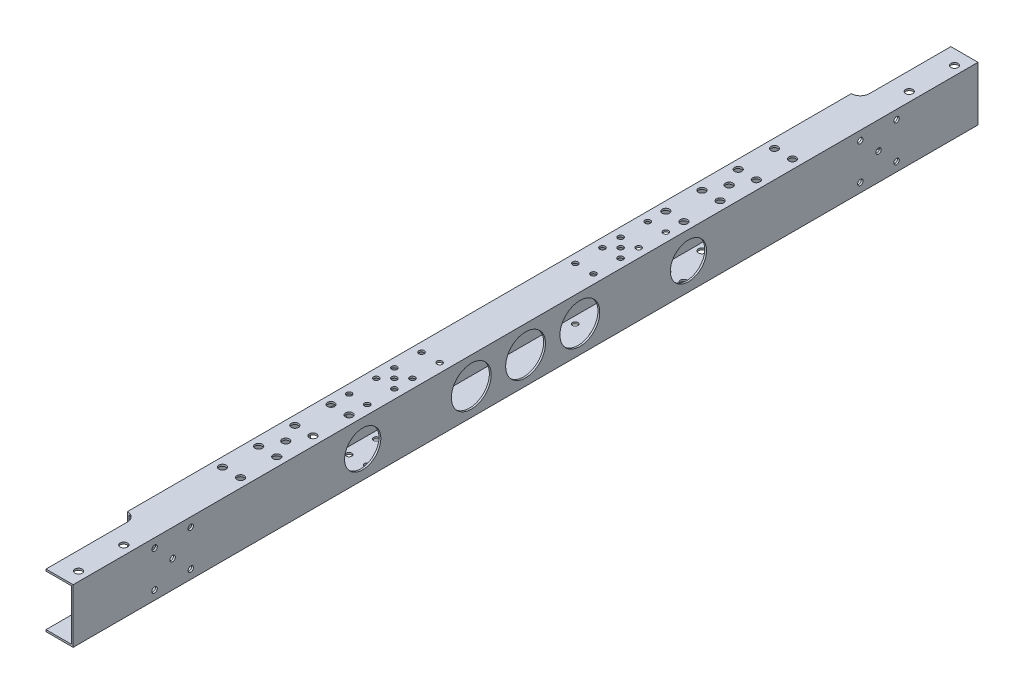
from build123d import *

# Parameters (mm, degrees)
SKETCH_1_W          = 20
SKETCH_1_H          = 30
SKETCH_1_W_2        = 18
SKETCH_1_H_2        = 28
EXTRUDE_1_DEPTH     = 500
CUT_EXTRUDE_1_REACH = 502.999
SKETCH_2_R          = 1.5
CUT_EXTRUDE_3_REACH = 502.999
SKETCH_4_W          = 5
SKETCH_4_H          = 50
FILLET_1_R          = 5
CUT_EXTRUDE_4_REACH = 502.999
SKETCH_5_R          = 2
SKETCH_6_R          = 2
SKETCH_6_R_2        = 1.5
CUT_EXTRUDE_5_DEPTH = 30
CUT_EXTRUDE_6_REACH = 502.625
SKETCH_8_R          = 11
CUT_EXTRUDE_7_REACH = 502.625
SKETCH_9_R          = 1.5
SKETCH_9_R_2        = 10


with BuildPart() as part:
    # 草图1 → 拉伸-薄壁1 (new body)
    with BuildSketch(Plane.XY):
        Rectangle(SKETCH_1_W, SKETCH_1_H)
        Rectangle(SKETCH_1_W_2, SKETCH_1_H_2, mode=Mode.SUBTRACT)
    extrude(amount=EXTRUDE_1_DEPTH)

    # 切除-拉伸1: up to this face of the body (flat: up to its plane)
    cut_extrude_1_end = Plane(part.part.faces().sort_by_distance((0, -15, 250))[0])
    # 草图2 → 切除-拉伸1 (cut, up to the picked face)
    with BuildSketch(Plane(origin=(0, 15, 0), x_dir=(1, 0, 0), z_dir=(0, 1, 0)), mode=Mode.PRIVATE) as cut_extrude_1_sk1:
        with Locations(Location((5, -182.5, 0), (0, 0, 270))):
            Circle(SKETCH_2_R)
    cut_extrude_1_tool1 = split(extrude(cut_extrude_1_sk1.sketch, amount=-CUT_EXTRUDE_1_REACH, mode=Mode.PRIVATE), bisect_by=cut_extrude_1_end, keep=Keep.BOTH, mode=Mode.PRIVATE)
    # 草图2 → 切除-拉伸1 (cut, up to the picked face)
    with BuildSketch(Plane(origin=(0, 15, 0), x_dir=(1, 0, 0), z_dir=(0, 1, 0)), mode=Mode.PRIVATE) as cut_extrude_1_sk2:
        with Locations(Location((5, -192.5, 0), (0, 0, 270))):
            Circle(SKETCH_2_R)
    cut_extrude_1_tool2 = split(extrude(cut_extrude_1_sk2.sketch, amount=-CUT_EXTRUDE_1_REACH, mode=Mode.PRIVATE), bisect_by=cut_extrude_1_end, keep=Keep.BOTH, mode=Mode.PRIVATE)
    # 草图2 → 切除-拉伸1 (cut, up to the picked face)
    with BuildSketch(Plane(origin=(0, 15, 0), x_dir=(1, 0, 0), z_dir=(0, 1, 0)), mode=Mode.PRIVATE) as cut_extrude_1_sk3:
        with Locations(Location((-5, -192.5, 0), (0, 0, 270))):
            Circle(SKETCH_2_R)
    cut_extrude_1_tool3 = split(extrude(cut_extrude_1_sk3.sketch, amount=-CUT_EXTRUDE_1_REACH, mode=Mode.PRIVATE), bisect_by=cut_extrude_1_end, keep=Keep.BOTH, mode=Mode.PRIVATE)
    # 草图2 → 切除-拉伸1 (cut, up to the picked face)
    with BuildSketch(Plane(origin=(0, 15, 0), x_dir=(1, 0, 0), z_dir=(0, 1, 0)), mode=Mode.PRIVATE) as cut_extrude_1_sk4:
        with Locations(Location((-5, -182.5, 0), (0, 0, 270))):
            Circle(SKETCH_2_R)
    cut_extrude_1_tool4 = split(extrude(cut_extrude_1_sk4.sketch, amount=-CUT_EXTRUDE_1_REACH, mode=Mode.PRIVATE), bisect_by=cut_extrude_1_end, keep=Keep.BOTH, mode=Mode.PRIVATE)
    # 草图2 → 切除-拉伸1 (cut, up to the picked face)
    with BuildSketch(Plane(origin=(0, 15, 0), x_dir=(1, 0, 0), z_dir=(0, 1, 0)), mode=Mode.PRIVATE) as cut_extrude_1_sk5:
        with Locations(Location((-5, -317.5, 0), (0, 0, 270))):
            Circle(SKETCH_2_R)
    cut_extrude_1_tool5 = split(extrude(cut_extrude_1_sk5.sketch, amount=-CUT_EXTRUDE_1_REACH, mode=Mode.PRIVATE), bisect_by=cut_extrude_1_end, keep=Keep.BOTH, mode=Mode.PRIVATE)
    # 草图2 → 切除-拉伸1 (cut, up to the picked face)
    with BuildSketch(Plane(origin=(0, 15, 0), x_dir=(1, 0, 0), z_dir=(0, 1, 0)), mode=Mode.PRIVATE) as cut_extrude_1_sk6:
        with Locations(Location((-5, -307.5, 0), (0, 0, 270))):
            Circle(SKETCH_2_R)
    cut_extrude_1_tool6 = split(extrude(cut_extrude_1_sk6.sketch, amount=-CUT_EXTRUDE_1_REACH, mode=Mode.PRIVATE), bisect_by=cut_extrude_1_end, keep=Keep.BOTH, mode=Mode.PRIVATE)
    # 草图2 → 切除-拉伸1 (cut, up to the picked face)
    with BuildSketch(Plane(origin=(0, 15, 0), x_dir=(1, 0, 0), z_dir=(0, 1, 0)), mode=Mode.PRIVATE) as cut_extrude_1_sk7:
        with Locations(Location((5, -307.5, 0), (0, 0, 270))):
            Circle(SKETCH_2_R)
    cut_extrude_1_tool7 = split(extrude(cut_extrude_1_sk7.sketch, amount=-CUT_EXTRUDE_1_REACH, mode=Mode.PRIVATE), bisect_by=cut_extrude_1_end, keep=Keep.BOTH, mode=Mode.PRIVATE)
    # 草图2 → 切除-拉伸1 (cut, up to the picked face)
    with BuildSketch(Plane(origin=(0, 15, 0), x_dir=(1, 0, 0), z_dir=(0, 1, 0)), mode=Mode.PRIVATE) as cut_extrude_1_sk8:
        with Locations(Location((5, -317.5, 0), (0, 0, 270))):
            Circle(SKETCH_2_R)
    cut_extrude_1_tool8 = split(extrude(cut_extrude_1_sk8.sketch, amount=-CUT_EXTRUDE_1_REACH, mode=Mode.PRIVATE), bisect_by=cut_extrude_1_end, keep=Keep.BOTH, mode=Mode.PRIVATE)
    add(cut_extrude_1_tool1.solids().sort_by(Axis((5, 15, 182.5), (0, -1, 0)))[0], mode=Mode.SUBTRACT)
    add(cut_extrude_1_tool2.solids().sort_by(Axis((5, 15, 192.5), (0, -1, 0)))[0], mode=Mode.SUBTRACT)
    add(cut_extrude_1_tool3.solids().sort_by(Axis((-5, 15, 192.5), (0, -1, 0)))[0], mode=Mode.SUBTRACT)
    add(cut_extrude_1_tool4.solids().sort_by(Axis((-5, 15, 182.5), (0, -1, 0)))[0], mode=Mode.SUBTRACT)
    add(cut_extrude_1_tool5.solids().sort_by(Axis((-5, 15, 317.5), (0, -1, 0)))[0], mode=Mode.SUBTRACT)
    add(cut_extrude_1_tool6.solids().sort_by(Axis((-5, 15, 307.5), (0, -1, 0)))[0], mode=Mode.SUBTRACT)
    add(cut_extrude_1_tool7.solids().sort_by(Axis((5, 15, 307.5), (0, -1, 0)))[0], mode=Mode.SUBTRACT)
    add(cut_extrude_1_tool8.solids().sort_by(Axis((5, 15, 317.5), (0, -1, 0)))[0], mode=Mode.SUBTRACT)

    # 切除-拉伸3: up to this face of the body (flat: up to its plane)
    cut_extrude_3_end = Plane(part.part.faces().sort_by_distance((0, -15, 250))[0])
    # 草图4 → 切除-拉伸3 (cut, up to the picked face)
    with BuildSketch(Plane(origin=(0, 15, 0), x_dir=(1, 0, 0), z_dir=(0, 1, 0)), mode=Mode.PRIVATE) as cut_extrude_3_sk1:
        with Locations((-7.5, -475)):
            Rectangle(SKETCH_4_W, SKETCH_4_H)
    cut_extrude_3_tool1 = split(extrude(cut_extrude_3_sk1.sketch, amount=-CUT_EXTRUDE_3_REACH, mode=Mode.PRIVATE), bisect_by=cut_extrude_3_end, keep=Keep.BOTH, mode=Mode.PRIVATE)
    # 草图4 → 切除-拉伸3 (cut, up to the picked face)
    with BuildSketch(Plane(origin=(0, 15, 0), x_dir=(1, 0, 0), z_dir=(0, 1, 0)), mode=Mode.PRIVATE) as cut_extrude_3_sk2:
        with Locations((-7.5, -25)):
            Rectangle(SKETCH_4_W, SKETCH_4_H)
    cut_extrude_3_tool2 = split(extrude(cut_extrude_3_sk2.sketch, amount=-CUT_EXTRUDE_3_REACH, mode=Mode.PRIVATE), bisect_by=cut_extrude_3_end, keep=Keep.BOTH, mode=Mode.PRIVATE)
    add(cut_extrude_3_tool1.solids().sort_by(Axis((-7.5, 15, 475), (0, -1, 0)))[0], mode=Mode.SUBTRACT)
    add(cut_extrude_3_tool2.solids().sort_by(Axis((-7.5, 15, 25), (0, -1, 0)))[0], mode=Mode.SUBTRACT)

    # 圆角1
    fillet_1_edges = [part.edges().sort_by_distance(p)[0] for p in [
        (-5, 14.5, 50),
    ]]
    fillet(fillet_1_edges, radius=FILLET_1_R - 0.0001)  # a hair under: the kernel refuses the full size
    fillet_1_2_edges = [part.edges().sort_by_distance(p)[0] for p in [
        (-5, 14.5, 450),
    ]]
    fillet(fillet_1_2_edges, radius=FILLET_1_R - 0.0001)  # a hair under: the kernel refuses the full size

    # 切除-拉伸4: up to this face of the body (flat: up to its plane)
    cut_extrude_4_end = Plane(part.part.faces().sort_by_distance((0.389707857, -15, 250))[0])
    # 草图5 → 切除-拉伸4 (cut, up to the picked face)
    with BuildSketch(Plane(origin=(0, 15, 0), x_dir=(1, 0, 0), z_dir=(0, 1, 0)), mode=Mode.PRIVATE) as cut_extrude_4_sk1:
        with Locations(Location((5, -8, 0), (0, 0, 270))):
            Circle(SKETCH_5_R)
    cut_extrude_4_tool1 = split(extrude(cut_extrude_4_sk1.sketch, amount=-CUT_EXTRUDE_4_REACH, mode=Mode.PRIVATE), bisect_by=cut_extrude_4_end, keep=Keep.BOTH, mode=Mode.PRIVATE)
    # 草图5 → 切除-拉伸4 (cut, up to the picked face)
    with BuildSketch(Plane(origin=(0, 15, 0), x_dir=(1, 0, 0), z_dir=(0, 1, 0)), mode=Mode.PRIVATE) as cut_extrude_4_sk2:
        with Locations(Location((5, -33, 0), (0, 0, 270))):
            Circle(SKETCH_5_R)
    cut_extrude_4_tool2 = split(extrude(cut_extrude_4_sk2.sketch, amount=-CUT_EXTRUDE_4_REACH, mode=Mode.PRIVATE), bisect_by=cut_extrude_4_end, keep=Keep.BOTH, mode=Mode.PRIVATE)
    # 草图5 → 切除-拉伸4 (cut, up to the picked face)
    with BuildSketch(Plane(origin=(0, 15, 0), x_dir=(1, 0, 0), z_dir=(0, 1, 0)), mode=Mode.PRIVATE) as cut_extrude_4_sk3:
        with Locations(Location((5, -467, 0), (0, 0, 270))):
            Circle(SKETCH_5_R)
    cut_extrude_4_tool3 = split(extrude(cut_extrude_4_sk3.sketch, amount=-CUT_EXTRUDE_4_REACH, mode=Mode.PRIVATE), bisect_by=cut_extrude_4_end, keep=Keep.BOTH, mode=Mode.PRIVATE)
    # 草图5 → 切除-拉伸4 (cut, up to the picked face)
    with BuildSketch(Plane(origin=(0, 15, 0), x_dir=(1, 0, 0), z_dir=(0, 1, 0)), mode=Mode.PRIVATE) as cut_extrude_4_sk4:
        with Locations(Location((5, -492, 0), (0, 0, 270))):
            Circle(SKETCH_5_R)
    cut_extrude_4_tool4 = split(extrude(cut_extrude_4_sk4.sketch, amount=-CUT_EXTRUDE_4_REACH, mode=Mode.PRIVATE), bisect_by=cut_extrude_4_end, keep=Keep.BOTH, mode=Mode.PRIVATE)
    add(cut_extrude_4_tool1.solids().sort_by(Axis((5, 15, 8), (0, -1, 0)))[0], mode=Mode.SUBTRACT)
    add(cut_extrude_4_tool2.solids().sort_by(Axis((5, 15, 33), (0, -1, 0)))[0], mode=Mode.SUBTRACT)
    add(cut_extrude_4_tool3.solids().sort_by(Axis((5, 15, 467), (0, -1, 0)))[0], mode=Mode.SUBTRACT)
    add(cut_extrude_4_tool4.solids().sort_by(Axis((5, 15, 492), (0, -1, 0)))[0], mode=Mode.SUBTRACT)

    # 草图6 → 切除-拉伸5 (cut)
    with BuildSketch(Plane(origin=(0, 15, 0), x_dir=(1, 0, 0), z_dir=(0, 1, 0))):
        with Locations(Location((5, -97.5, 0), (0, 0, 270))):
            Circle(SKETCH_6_R)
        with Locations(Location((5, -117.5, 0), (0, 0, 270))):
            Circle(SKETCH_6_R)
        with Locations(Location((5, -137.5, 0), (0, 0, 270))):
            Circle(SKETCH_6_R)
        with Locations(Location((5, -157.5, 0), (0, 0, 270))):
            Circle(SKETCH_6_R)
        with Locations(Location((-5, -157.5, 0), (0, 0, 270))):
            Circle(SKETCH_6_R)
        with Locations(Location((-5, -137.5, 0), (0, 0, 270))):
            Circle(SKETCH_6_R)
        with Locations(Location((-5, -117.5, 0), (0, 0, 270))):
            Circle(SKETCH_6_R)
        with Locations(Location((-5, -97.5, 0), (0, 0, 270))):
            Circle(SKETCH_6_R)
        with Locations(Location((0, -127.5, 0), (0, 0, 270))):
            Circle(SKETCH_6_R)
        with Locations(Location((5, -167.5, 0), (0, 0, 270))):
            Circle(SKETCH_6_R_2)
        with Locations(Location((-5, -167.5, 0), (0, 0, 270))):
            Circle(SKETCH_6_R_2)
        with Locations(Location((-5, -332.5, 0), (0, 0, 270))):
            Circle(SKETCH_6_R_2)
        with Locations(Location((5, -332.5, 0), (0, 0, 270))):
            Circle(SKETCH_6_R_2)
        with Locations(Location((0, -372.5, 0), (0, 0, 270))):
            Circle(SKETCH_6_R)
        with Locations(Location((-5, -402.5, 0), (0, 0, 270))):
            Circle(SKETCH_6_R)
        with Locations(Location((-5, -382.5, 0), (0, 0, 270))):
            Circle(SKETCH_6_R)
        with Locations(Location((-5, -362.5, 0), (0, 0, 270))):
            Circle(SKETCH_6_R)
        with Locations(Location((-5, -342.5, 0), (0, 0, 270))):
            Circle(SKETCH_6_R)
        with Locations(Location((5, -342.5, 0), (0, 0, 270))):
            Circle(SKETCH_6_R)
        with Locations(Location((5, -362.5, 0), (0, 0, 270))):
            Circle(SKETCH_6_R)
        with Locations(Location((5, -382.5, 0), (0, 0, 270))):
            Circle(SKETCH_6_R)
        with Locations(Location((5, -402.5, 0), (0, 0, 270))):
            Circle(SKETCH_6_R)
        with Locations(Location((0, -187.5, 0), (0, 0, 270))):
            Circle(SKETCH_6_R_2)
        with Locations(Location((-5, -207.5, 0), (0, 0, 270))):
            Circle(SKETCH_6_R_2)
        with Locations(Location((5, -207.5, 0), (0, 0, 270))):
            Circle(SKETCH_6_R_2)
        with Locations(Location((5, -292.5, 0), (0, 0, 270))):
            Circle(SKETCH_6_R_2)
        with Locations(Location((-5, -292.5, 0), (0, 0, 270))):
            Circle(SKETCH_6_R_2)
        with Locations(Location((0, -312.5, 0), (0, 0, 270))):
            Circle(SKETCH_6_R_2)
    extrude(amount=-CUT_EXTRUDE_5_DEPTH, mode=Mode.SUBTRACT)

    # 切除-拉伸6: up to this face of the body (flat: up to its plane)
    cut_extrude_6_end = Plane(part.part.faces().sort_by_distance((10, 0, 250))[0])
    # 草图8 → 切除-拉伸6 (cut, up to the picked face)
    with BuildSketch(Plane.ZY.offset(10), mode=Mode.PRIVATE) as cut_extrude_6_sk1:
        with Locations((250, 0)):
            Circle(SKETCH_8_R)
    cut_extrude_6_tool1 = split(extrude(cut_extrude_6_sk1.sketch, amount=-CUT_EXTRUDE_6_REACH, mode=Mode.PRIVATE), bisect_by=cut_extrude_6_end, keep=Keep.BOTH, mode=Mode.PRIVATE)
    # 草图8 → 切除-拉伸6 (cut, up to the picked face)
    with BuildSketch(Plane.ZY.offset(10), mode=Mode.PRIVATE) as cut_extrude_6_sk2:
        with Locations((280, 0)):
            Circle(SKETCH_8_R)
    cut_extrude_6_tool2 = split(extrude(cut_extrude_6_sk2.sketch, amount=-CUT_EXTRUDE_6_REACH, mode=Mode.PRIVATE), bisect_by=cut_extrude_6_end, keep=Keep.BOTH, mode=Mode.PRIVATE)
    # 草图8 → 切除-拉伸6 (cut, up to the picked face)
    with BuildSketch(Plane.ZY.offset(10), mode=Mode.PRIVATE) as cut_extrude_6_sk3:
        with Locations((220, 0)):
            Circle(SKETCH_8_R)
    cut_extrude_6_tool3 = split(extrude(cut_extrude_6_sk3.sketch, amount=-CUT_EXTRUDE_6_REACH, mode=Mode.PRIVATE), bisect_by=cut_extrude_6_end, keep=Keep.BOTH, mode=Mode.PRIVATE)
    add(cut_extrude_6_tool1.solids().sort_by(Axis((-10, 0, 250), (1, 0, 0)))[0], mode=Mode.SUBTRACT)
    add(cut_extrude_6_tool2.solids().sort_by(Axis((-10, 0, 280), (1, 0, 0)))[0], mode=Mode.SUBTRACT)
    add(cut_extrude_6_tool3.solids().sort_by(Axis((-10, 0, 220), (1, 0, 0)))[0], mode=Mode.SUBTRACT)

    # 切除-拉伸7: up to this face of the body (flat: up to its plane)
    cut_extrude_7_end = Plane(part.part.faces().sort_by_distance((-10, 0, 54.011234224))[0])
    # 草图9 → 切除-拉伸7 (cut, up to the picked face)
    with BuildSketch(Plane(origin=(10, 0, 0), x_dir=(0, 0, -1), z_dir=(1, 0, 0)), mode=Mode.PRIVATE) as cut_extrude_7_sk1:
        with Locations((-45, 10)):
            Circle(SKETCH_9_R)
    cut_extrude_7_tool1 = split(extrude(cut_extrude_7_sk1.sketch, amount=-CUT_EXTRUDE_7_REACH, mode=Mode.PRIVATE), bisect_by=cut_extrude_7_end, keep=Keep.BOTH, mode=Mode.PRIVATE)
    # 草图9 → 切除-拉伸7 (cut, up to the picked face)
    with BuildSketch(Plane(origin=(10, 0, 0), x_dir=(0, 0, -1), z_dir=(1, 0, 0)), mode=Mode.PRIVATE) as cut_extrude_7_sk2:
        with Locations((-45, -10)):
            Circle(SKETCH_9_R)
    cut_extrude_7_tool2 = split(extrude(cut_extrude_7_sk2.sketch, amount=-CUT_EXTRUDE_7_REACH, mode=Mode.PRIVATE), bisect_by=cut_extrude_7_end, keep=Keep.BOTH, mode=Mode.PRIVATE)
    # 草图9 → 切除-拉伸7 (cut, up to the picked face)
    with BuildSketch(Plane(origin=(10, 0, 0), x_dir=(0, 0, -1), z_dir=(1, 0, 0)), mode=Mode.PRIVATE) as cut_extrude_7_sk3:
        with Locations((-65, -10)):
            Circle(SKETCH_9_R)
    cut_extrude_7_tool3 = split(extrude(cut_extrude_7_sk3.sketch, amount=-CUT_EXTRUDE_7_REACH, mode=Mode.PRIVATE), bisect_by=cut_extrude_7_end, keep=Keep.BOTH, mode=Mode.PRIVATE)
    # 草图9 → 切除-拉伸7 (cut, up to the picked face)
    with BuildSketch(Plane(origin=(10, 0, 0), x_dir=(0, 0, -1), z_dir=(1, 0, 0)), mode=Mode.PRIVATE) as cut_extrude_7_sk4:
        with Locations((-65, 10)):
            Circle(SKETCH_9_R)
    cut_extrude_7_tool4 = split(extrude(cut_extrude_7_sk4.sketch, amount=-CUT_EXTRUDE_7_REACH, mode=Mode.PRIVATE), bisect_by=cut_extrude_7_end, keep=Keep.BOTH, mode=Mode.PRIVATE)
    # 草图9 → 切除-拉伸7 (cut, up to the picked face)
    with BuildSketch(Plane(origin=(10, 0, 0), x_dir=(0, 0, -1), z_dir=(1, 0, 0)), mode=Mode.PRIVATE) as cut_extrude_7_sk5:
        with Locations((-55, 0)):
            Circle(SKETCH_9_R)
    cut_extrude_7_tool5 = split(extrude(cut_extrude_7_sk5.sketch, amount=-CUT_EXTRUDE_7_REACH, mode=Mode.PRIVATE), bisect_by=cut_extrude_7_end, keep=Keep.BOTH, mode=Mode.PRIVATE)
    # 草图9 → 切除-拉伸7 (cut, up to the picked face)
    with BuildSketch(Plane(origin=(10, 0, 0), x_dir=(0, 0, -1), z_dir=(1, 0, 0)), mode=Mode.PRIVATE) as cut_extrude_7_sk6:
        with Locations((-445, 0)):
            Circle(SKETCH_9_R)
    cut_extrude_7_tool6 = split(extrude(cut_extrude_7_sk6.sketch, amount=-CUT_EXTRUDE_7_REACH, mode=Mode.PRIVATE), bisect_by=cut_extrude_7_end, keep=Keep.BOTH, mode=Mode.PRIVATE)
    # 草图9 → 切除-拉伸7 (cut, up to the picked face)
    with BuildSketch(Plane(origin=(10, 0, 0), x_dir=(0, 0, -1), z_dir=(1, 0, 0)), mode=Mode.PRIVATE) as cut_extrude_7_sk7:
        with Locations((-435, 10)):
            Circle(SKETCH_9_R)
    cut_extrude_7_tool7 = split(extrude(cut_extrude_7_sk7.sketch, amount=-CUT_EXTRUDE_7_REACH, mode=Mode.PRIVATE), bisect_by=cut_extrude_7_end, keep=Keep.BOTH, mode=Mode.PRIVATE)
    # 草图9 → 切除-拉伸7 (cut, up to the picked face)
    with BuildSketch(Plane(origin=(10, 0, 0), x_dir=(0, 0, -1), z_dir=(1, 0, 0)), mode=Mode.PRIVATE) as cut_extrude_7_sk8:
        with Locations((-435, -10)):
            Circle(SKETCH_9_R)
    cut_extrude_7_tool8 = split(extrude(cut_extrude_7_sk8.sketch, amount=-CUT_EXTRUDE_7_REACH, mode=Mode.PRIVATE), bisect_by=cut_extrude_7_end, keep=Keep.BOTH, mode=Mode.PRIVATE)
    # 草图9 → 切除-拉伸7 (cut, up to the picked face)
    with BuildSketch(Plane(origin=(10, 0, 0), x_dir=(0, 0, -1), z_dir=(1, 0, 0)), mode=Mode.PRIVATE) as cut_extrude_7_sk9:
        with Locations(Location((-455, -10, 0), (0, 0, 180))):
            Circle(SKETCH_9_R)
    cut_extrude_7_tool9 = split(extrude(cut_extrude_7_sk9.sketch, amount=-CUT_EXTRUDE_7_REACH, mode=Mode.PRIVATE), bisect_by=cut_extrude_7_end, keep=Keep.BOTH, mode=Mode.PRIVATE)
    # 草图9 → 切除-拉伸7 (cut, up to the picked face)
    with BuildSketch(Plane(origin=(10, 0, 0), x_dir=(0, 0, -1), z_dir=(1, 0, 0)), mode=Mode.PRIVATE) as cut_extrude_7_sk10:
        with Locations(Location((-455, 10, 0), (0, 0, 180))):
            Circle(SKETCH_9_R)
    cut_extrude_7_tool10 = split(extrude(cut_extrude_7_sk10.sketch, amount=-CUT_EXTRUDE_7_REACH, mode=Mode.PRIVATE), bisect_by=cut_extrude_7_end, keep=Keep.BOTH, mode=Mode.PRIVATE)
    # 草图9 → 切除-拉伸7 (cut, up to the picked face)
    with BuildSketch(Plane(origin=(10, 0, 0), x_dir=(0, 0, -1), z_dir=(1, 0, 0)), mode=Mode.PRIVATE) as cut_extrude_7_sk11:
        with Locations((-160, 0)):
            Circle(SKETCH_9_R_2)
    cut_extrude_7_tool11 = split(extrude(cut_extrude_7_sk11.sketch, amount=-CUT_EXTRUDE_7_REACH, mode=Mode.PRIVATE), bisect_by=cut_extrude_7_end, keep=Keep.BOTH, mode=Mode.PRIVATE)
    # 草图9 → 切除-拉伸7 (cut, up to the picked face)
    with BuildSketch(Plane(origin=(10, 0, 0), x_dir=(0, 0, -1), z_dir=(1, 0, 0)), mode=Mode.PRIVATE) as cut_extrude_7_sk12:
        with Locations((-340, 0)):
            Circle(SKETCH_9_R_2)
    cut_extrude_7_tool12 = split(extrude(cut_extrude_7_sk12.sketch, amount=-CUT_EXTRUDE_7_REACH, mode=Mode.PRIVATE), bisect_by=cut_extrude_7_end, keep=Keep.BOTH, mode=Mode.PRIVATE)
    add(cut_extrude_7_tool1.solids().sort_by(Axis((10, 10, 45), (-1, 0, 0)))[0], mode=Mode.SUBTRACT)
    add(cut_extrude_7_tool2.solids().sort_by(Axis((10, -10, 45), (-1, 0, 0)))[0], mode=Mode.SUBTRACT)
    add(cut_extrude_7_tool3.solids().sort_by(Axis((10, -10, 65), (-1, 0, 0)))[0], mode=Mode.SUBTRACT)
    add(cut_extrude_7_tool4.solids().sort_by(Axis((10, 10, 65), (-1, 0, 0)))[0], mode=Mode.SUBTRACT)
    add(cut_extrude_7_tool5.solids().sort_by(Axis((10, 0, 55), (-1, 0, 0)))[0], mode=Mode.SUBTRACT)
    add(cut_extrude_7_tool6.solids().sort_by(Axis((10, 0, 445), (-1, 0, 0)))[0], mode=Mode.SUBTRACT)
    add(cut_extrude_7_tool7.solids().sort_by(Axis((10, 10, 435), (-1, 0, 0)))[0], mode=Mode.SUBTRACT)
    add(cut_extrude_7_tool8.solids().sort_by(Axis((10, -10, 435), (-1, 0, 0)))[0], mode=Mode.SUBTRACT)
    add(cut_extrude_7_tool9.solids().sort_by(Axis((10, -10, 455), (-1, 0, 0)))[0], mode=Mode.SUBTRACT)
    add(cut_extrude_7_tool10.solids().sort_by(Axis((10, 10, 455), (-1, 0, 0)))[0], mode=Mode.SUBTRACT)
    add(cut_extrude_7_tool11.solids().sort_by(Axis((10, 0, 160), (-1, 0, 0)))[0], mode=Mode.SUBTRACT)
    add(cut_extrude_7_tool12.solids().sort_by(Axis((10, 0, 340), (-1, 0, 0)))[0], mode=Mode.SUBTRACT)


solid = part.part
